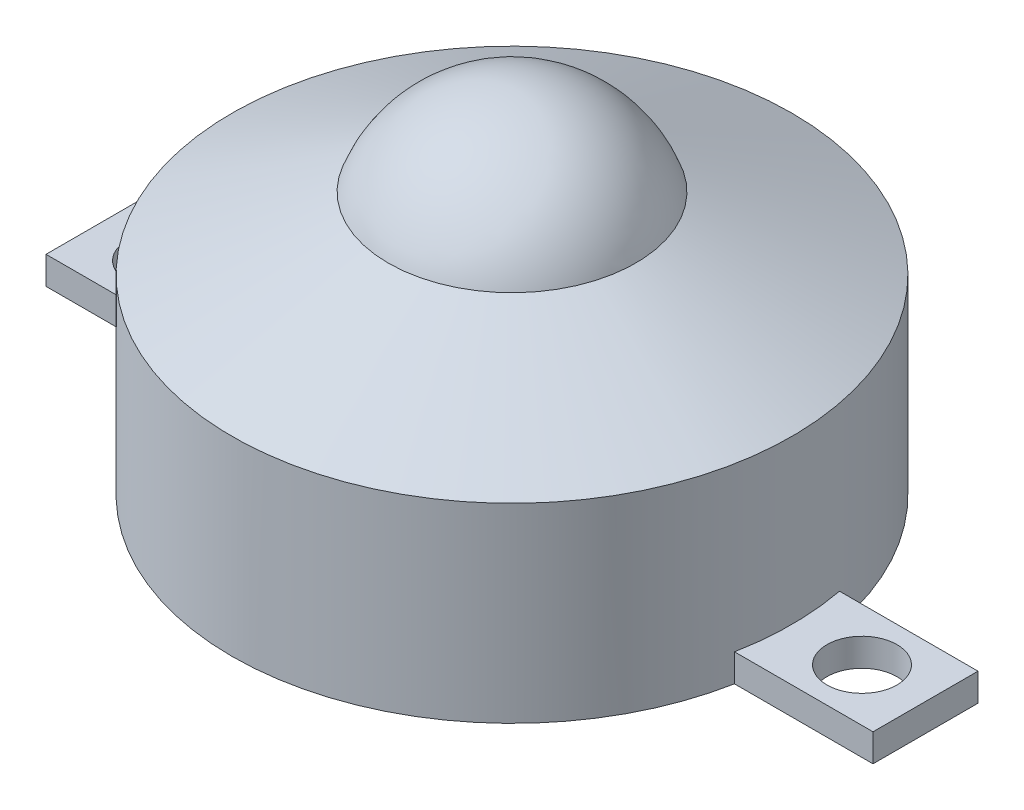
from build123d import *

# Parameters (mm, degrees)
BOSS_EXTRUDE1_START = -1.5875
SKETCH5_R           = 2
BOSS_EXTRUDE1_DEPTH = 1.5875


with BuildPart() as part:
    # Sketch1 → Revolve2 (revolve)
    with BuildSketch(Plane.XY):
        with BuildLine():
            Line((0, 15), (0, 0))
            Line((0, 0), (16, 0))
            Line((16, 0), (16, 10.891346557))
            Line((16, 10.891346557), (7.07, 15))
            ThreePointArc((7.07, 15), (4.32968577, 18.623685679), (0, 20))
            Line((0, 20), (0, 15))
        make_face()
    revolve(axis=Axis((0, 0, 0), (0, 1, 0)))

    # Sketch5 → Boss-Extrude1 (add)
    with BuildSketch(Plane.XZ.offset(BOSS_EXTRUDE1_START)):
        with BuildLine():
            Line((23.630800275, 0), (23.630800275, 3))
            Line((23.630800275, 3), (15.716233646, 3))
            ThreePointArc((15.716233646, 3), (0, 16), (-15.716233646, 3))
            Line((-15.716233646, 3), (-23.630800275, 3))
            Line((-23.630800275, 3), (-23.630800275, 0))
            Line((-23.630800275, 0), (-23.630800275, -3))
            Line((-23.630800275, -3), (-15.716233646, -3))
            ThreePointArc((-15.716233646, -3), (0, -16), (15.716233646, -3))
            Line((15.716233646, -3), (23.630800275, -3))
            Line((23.630800275, -3), (23.630800275, 0))
        make_face()
        with Locations((-20, 0)):
            Circle(SKETCH5_R, mode=Mode.SUBTRACT)
        with Locations((20, 0)):
            Circle(SKETCH5_R, mode=Mode.SUBTRACT)
    extrude(amount=BOSS_EXTRUDE1_DEPTH)


solid = part.part
